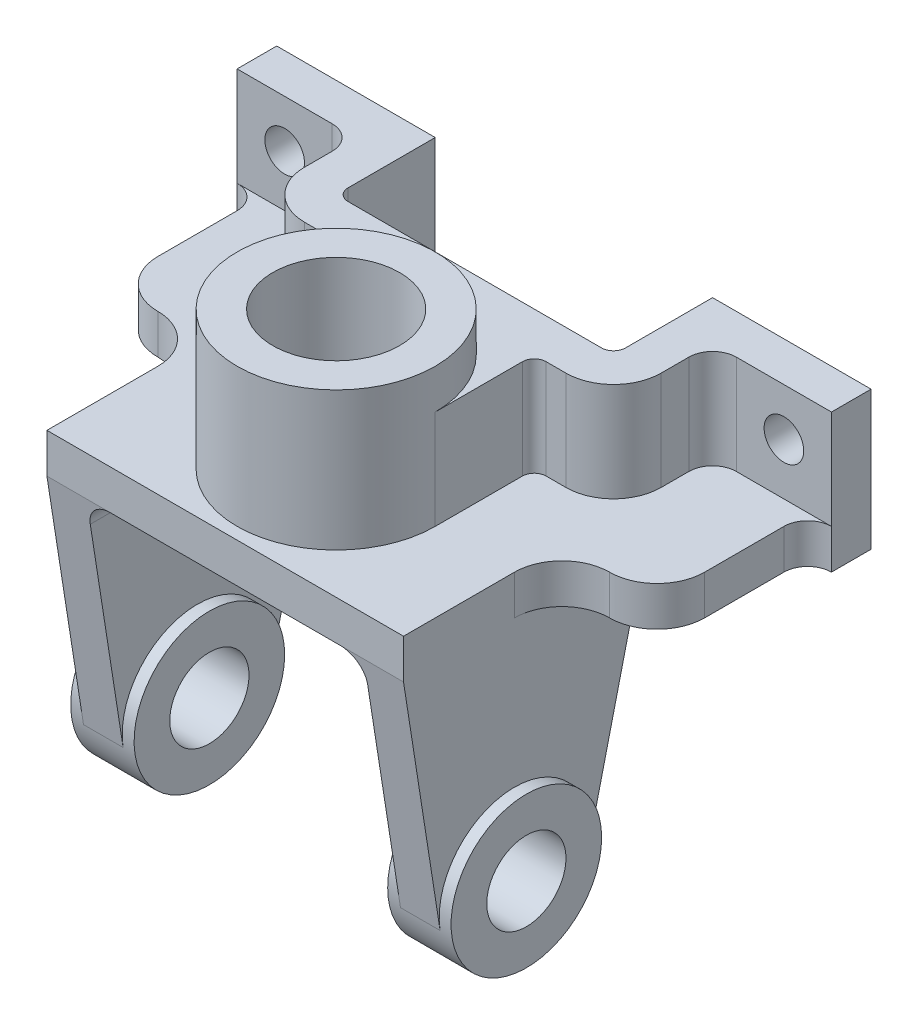
from build123d import *

# Parameters (mm, degrees)
SKETCH1_R                = 25
SKETCH1_R_2              = 16
BOSS_EXTRUDE1_DEPTH      = 45
BOSS_EXTRUDE2_DEPTH      = 10
BOSS_EXTRUDE3_DEPTH      = 35
FILLET1_R                = 12
FILLET2_R                = 12
FILLET3_R                = 6
FILLET4_R                = 12
FILLET5_R                = 3
FILLET6_R                = 6
BOSS_EXTRUDE4_DEPTH      = 48
BOSS_EXTRUDE4_DEPTH_BACK = 48
SKETCH2_R                = 19
SKETCH2_R_2              = 10
BOSS_EXTRUDE5_DEPTH      = 45
BOSS_EXTRUDE5_DEPTH_BACK = 45
SKETCH3_W                = 70
SKETCH3_H                = 86.046908332
CUT_EXTRUDE1_DEPTH       = 138.818721515
FILLET7_R                = 6
SKETCH4_R                = 5
CUT_EXTRUDE2_DEPTH       = 132.658649545
SKETCH6_R                = 19
SKETCH6_R_2              = 10
BOSS_EXTRUDE7_DEPTH      = 16
SKETCH7_R                = 19
SKETCH7_R_2              = 10
BOSS_EXTRUDE8_DEPTH      = 16


with BuildPart() as part:
    # Sketch1 → Boss-Extrude1 (new body)
    with BuildSketch(Plane(origin=(0, 0, 0), x_dir=(1, 0, 0), z_dir=(0, 1, 0))):
        with Locations(Location((0, 0, 0), (0, 0, 90))):
            Circle(SKETCH1_R)
        with Locations(Location((0, 0, 0), (0, 0, 90))):
            Circle(SKETCH1_R_2, mode=Mode.SUBTRACT)
    extrude(amount=BOSS_EXTRUDE1_DEPTH)

    # Sketch1<3> → Boss-Extrude2 (add)
    with BuildSketch(Plane(origin=(0, 0, 0), x_dir=(1, 0, 0), z_dir=(0, 1, 0))):
        with BuildLine():
            Line((-45, 50), (-69, 50))
            Line((-69, 50), (-69, 12))
            Line((-69, 12), (-45, 12))
            Line((-45, 12), (-45, -28))
            Line((-45, -28), (45, -28))
            Line((45, -28), (45, 12))
            Line((45, 12), (69, 12))
            Line((69, 12), (69, 50))
            Line((69, 50), (45, 50))
            Line((45, 50), (45, 25))
            Line((45, 25), (25, 25))
            Line((25, 25), (25, 0))
            ThreePointArc((25, 0), (0, -25), (-25, 0))
            Line((-25, 0), (-25, 25))
            Line((-25, 25), (-45, 25))
            Line((-45, 25), (-45, 50))
        make_face()
    extrude(amount=BOSS_EXTRUDE2_DEPTH)

    # Sketch1<4> → Boss-Extrude3 (add)
    with BuildSketch(Plane(origin=(0, 0, 0), x_dir=(1, 0, 0), z_dir=(0, 1, 0))):
        with BuildLine():
            Line((-35, 35), (-35, 60))
            Line((-35, 60), (-75, 60))
            Line((-75, 60), (-75, 50))
            Line((-75, 50), (-69, 50))
            Line((-69, 50), (-45, 50))
            Line((-45, 50), (-45, 25))
            Line((-45, 25), (-25, 25))
            Line((-25, 25), (-25, 0))
            ThreePointArc((-25, 0), (0, 25), (25, 0))
            Line((25, 0), (25, 25))
            Line((25, 25), (45, 25))
            Line((45, 25), (45, 50))
            Line((45, 50), (69, 50))
            Line((69, 50), (75, 50))
            Line((75, 50), (75, 60))
            Line((75, 60), (35, 60))
            Line((35, 60), (35, 35))
            Line((35, 35), (-35, 35))
        make_face()
    extrude(amount=BOSS_EXTRUDE3_DEPTH)

    # Fillet1
    fillet1_edges = [part.edges().sort_by_distance(p)[0] for p in [
        (45, 22.5, -25),
        (-45, 22.5, -25),
    ]]
    fillet(fillet1_edges, radius=FILLET1_R)

    # Fillet2
    fillet2_edges = [part.edges().sort_by_distance(p)[0] for p in [
        (-45, 5, -12),
        (45, 5, -12),
    ]]
    fillet(fillet2_edges, radius=FILLET2_R)

    # Fillet3
    fillet3_edges = [part.edges().sort_by_distance(p)[0] for p in [
        (69, 5, -50),
        (-69, 5, -50),
    ]]
    fillet(fillet3_edges, radius=FILLET3_R - 0.0001)  # a hair under: the kernel refuses the full size

    # Fillet4
    fillet4_edges = [part.edges().sort_by_distance(p)[0] for p in [
        (69, 5, -12),
        (-69, 5, -12),
    ]]
    fillet(fillet4_edges, radius=FILLET4_R - 0.0001)  # a hair under: the kernel refuses the full size

    # Fillet5
    fillet5_edges = [part.edges().sort_by_distance(p)[0] for p in [
        (25, 22.5, -25),
        (35, 17.5, -35),
        (-35, 17.5, -35),
        (-25, 22.5, -25),
    ]]
    fillet(fillet5_edges, radius=FILLET5_R)

    # Fillet6
    fillet6_edges = [part.edges().sort_by_distance(p)[0] for p in [
        (45, 22.5, -50),
        (-45, 22.5, -50),
    ]]
    fillet(fillet6_edges, radius=FILLET6_R)



with BuildPart() as body_2:
    # Sketch2 → Boss-Extrude4 (new, two sides: drawn at the far end of the back side and taken through both)
    with BuildSketch(Plane(origin=(0, 0, 0), x_dir=(0, 0, -1), z_dir=(1, 0, 0)).offset(-BOSS_EXTRUDE4_DEPTH_BACK)):
        with Locations((0, -56)):
            Circle(SKETCH2_R)
        with Locations((0, -56)):
            Circle(SKETCH2_R_2, mode=Mode.SUBTRACT)
    extrude(amount=BOSS_EXTRUDE4_DEPTH + BOSS_EXTRUDE4_DEPTH_BACK)


with BuildPart() as part_1:
    add(part.part)

    add(body_2.part)  # Boss-Extrude5 merges body 2
    # Sketch2<4> → Boss-Extrude5 (add, two sides: drawn at the far end of the back side and taken through both)
    with BuildSketch(Plane(origin=(0, 0, 0), x_dir=(0, 0, -1), z_dir=(1, 0, 0)).offset(-BOSS_EXTRUDE5_DEPTH_BACK)):
        with BuildLine():
            Line((0, 0), (-28, 0))
            Line((-28, 0), (-18.771282059, -58.939212458))
            ThreePointArc((-18.771282059, -58.939212458), (-1.474048996, -37.057265785), (19, -56))
            ThreePointArc((19, -56), (18.868026287, -58.235527685), (18.473938523, -60.439999487))
            Line((18.473938523, -60.439999487), (33, 0))
            Line((33, 0), (24, 0))
            Line((24, 0), (12, 0))
            Line((12, 0), (0, 0))
        make_face()
    extrude(amount=BOSS_EXTRUDE5_DEPTH + BOSS_EXTRUDE5_DEPTH_BACK)

    # Sketch3 → Cut-Extrude1 (cut, through all)
    with BuildSketch(Plane.XY.offset(28)):
        with Locations((0, -43.023454166)):
            Rectangle(SKETCH3_W, SKETCH3_H)
    extrude(amount=-CUT_EXTRUDE1_DEPTH, mode=Mode.SUBTRACT)

    # Fillet7
    fillet7_edges = [part_1.edges().sort_by_distance(p)[0] for p in [
        (-35, 0, -2.5),
        (35, 0, -2.5),
    ]]
    fillet(fillet7_edges, radius=FILLET7_R)

    # Sketch4 → Cut-Extrude2 (cut, through all)
    with BuildSketch(Plane.XY.offset(-50)):
        with Locations((-63, 23)):
            Circle(SKETCH4_R)
        with Locations((62.999455964, 23)):
            Circle(SKETCH4_R)
    extrude(amount=-CUT_EXTRUDE2_DEPTH, mode=Mode.SUBTRACT)

    # Sketch6 → Boss-Extrude7 (add)
    with BuildSketch(Plane(origin=(-32, 0, 0), x_dir=(0, 0, -1), z_dir=(1, 0, 0))):
        with Locations((0, -56)):
            Circle(SKETCH6_R)
        with Locations((0, -56)):
            Circle(SKETCH6_R_2, mode=Mode.SUBTRACT)
    extrude(amount=-BOSS_EXTRUDE7_DEPTH)

    # Sketch7 → Boss-Extrude8 (add)
    with BuildSketch(Plane.ZY.offset(-32)):
        with Locations(Location((0, -56, 0), (0, 0, 180))):
            Circle(SKETCH7_R)
        with Locations(Location((0, -56, 0), (0, 0, 180))):
            Circle(SKETCH7_R_2, mode=Mode.SUBTRACT)
    extrude(amount=-BOSS_EXTRUDE8_DEPTH)


solid = part_1.part
